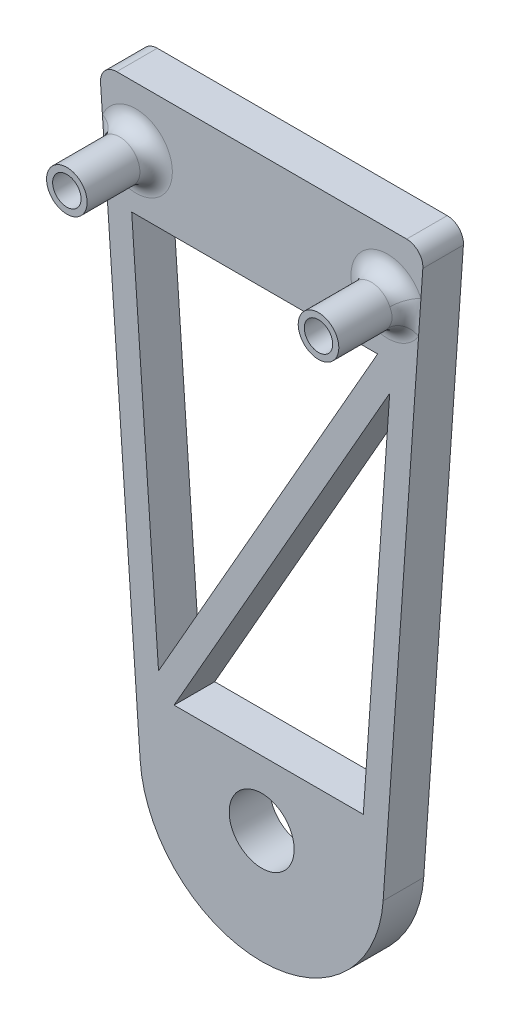
from build123d import *

# Parameters (mm, degrees)
CROQUIS1_R              = 4
CROQUIS1_R_2            = 1.75
SALIENTE_EXTRUIR1_DEPTH = 2.5
CROQUIS1_3_R            = 2.5
CROQUIS1_3_R_2          = 1.75
SALIENTE_EXTRUIR2_DEPTH = 11
REDONDEO1_R             = 2
REDONDEO2_R             = 2
CROQUIS2_R              = 3
CORTAR_EXTRUIR1_DEPTH   = 2


with BuildPart() as part:
    # Croquis1 → Saliente-Extruir1 (new, symmetric)
    with BuildSketch(Plane.XY):
        with BuildLine():
            Line((20.001432119, 0), (-20.001432119, 0))
            Line((-20.001432119, 0), (-14.963460754, -72.046347106))
            ThreePointArc((-14.963460754, -72.046347106), (0, -86), (14.963460754, -72.046347106))
            Line((14.963460754, -72.046347106), (20.001432119, 0))
        make_face()
        with Locations((0, -72.046347106)):
            Circle(CROQUIS1_R, mode=Mode.SUBTRACT)
        Polygon((-12.704099543, -61.349956664), (-16.011890152, -14.046347106), (14.28491785, -14.046347106), align=None, mode=Mode.SUBTRACT)
        Polygon((12.515549555, -64.046347106), (-10.788577252, -64.046347106), (15.770666891, -17.496000466), align=None, mode=Mode.SUBTRACT)
        with Locations((-15.5, -7.276347106)):
            Circle(CROQUIS1_R_2, mode=Mode.SUBTRACT)
        with Locations((15.5, -7.276347106)):
            Circle(CROQUIS1_R_2, mode=Mode.SUBTRACT)
    extrude(amount=SALIENTE_EXTRUIR1_DEPTH, both=True)

    # Croquis1<3> → Saliente-Extruir2 (add)
    # profile 1 of 2: a face of its own
    with BuildSketch(Plane.XY):
        with Locations((-15.5, -7.276347106)):
            Circle(CROQUIS1_3_R)
        with Locations((-15.5, -7.276347106)):
            Circle(CROQUIS1_3_R_2, mode=Mode.SUBTRACT)
    # profile 2 of 2: a face of its own
    with BuildSketch(Plane.XY):
        with Locations((15.5, -7.276347106)):
            Circle(CROQUIS1_3_R)
        with Locations((15.5, -7.276347106)):
            Circle(CROQUIS1_3_R_2, mode=Mode.SUBTRACT)
    extrude(amount=SALIENTE_EXTRUIR2_DEPTH)

    # Redondeo1
    redondeo1_edges = [part.edges().sort_by_distance(p)[0] for p in [
        (13, -7.276347106, 2.5),
        (-18, -7.276347106, 2.5),
    ]]
    fillet(redondeo1_edges, radius=REDONDEO1_R)

    # Redondeo2
    redondeo2_edges = [part.edges().sort_by_distance(p)[0] for p in [
        (20.001432119, 0, 0),
        (-20.001432119, 0, 0),
    ]]
    fillet(redondeo2_edges, radius=REDONDEO2_R)

    # Croquis2 → Cortar-Extruir1 (cut)
    with BuildSketch(Plane(origin=(0, 0, -2.5), x_dir=(-1, 0, 0), z_dir=(0, 0, -1))):
        with Locations((-15.5, -7.276347106)):
            Circle(CROQUIS2_R)
        with Locations((15.5, -7.276347106)):
            Circle(CROQUIS2_R)
    extrude(amount=-CORTAR_EXTRUIR1_DEPTH, mode=Mode.SUBTRACT)


solid = part.part
